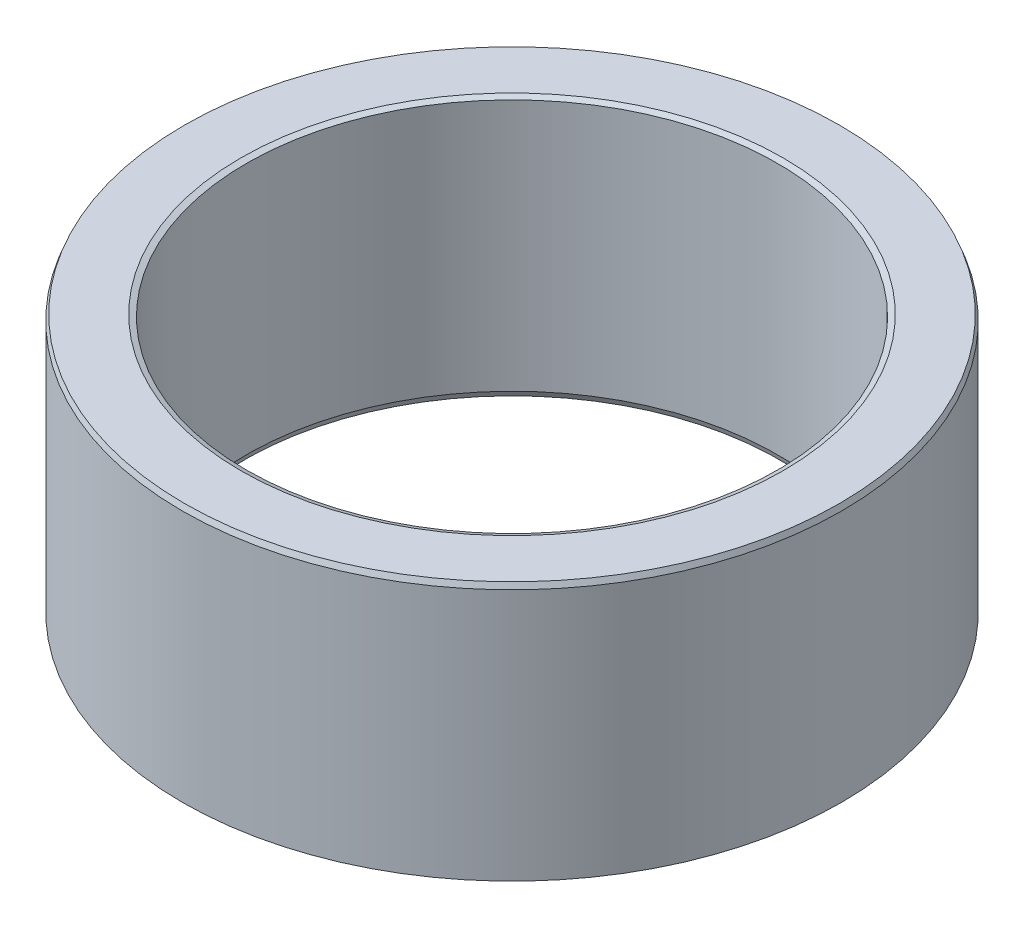
from build123d import *
from OCP.BRepFilletAPI import BRepFilletAPI_MakeChamfer

# Parameters (mm, degrees)
SKETCH1_R           = 57.5
BOSS_EXTRUDE1_DEPTH = 45.326889382
SKETCH2_R           = 46.317969934
CUT_EXTRUDE1_DEPTH  = 94.096868374
CHAMFER1_SIZE       = 0.954511824
CHAMFER1_SIZE2      = 0.363444751


with BuildPart() as part:
    # Sketch1 → Boss-Extrude1 (new body)
    with BuildSketch(Plane(origin=(0, 0, 0), x_dir=(1, 0, 0), z_dir=(0, 1, 0))):
        Circle(SKETCH1_R)
    extrude(amount=BOSS_EXTRUDE1_DEPTH)

    # Sketch2 → Cut-Extrude1 (cut, through all)
    with BuildSketch(Plane(origin=(0, 0, 0), x_dir=(1, 0, 0), z_dir=(0, 1, 0))):
        Circle(SKETCH2_R)
    extrude(amount=CUT_EXTRUDE1_DEPTH, mode=Mode.SUBTRACT)

    # Chamfer1: one chamfer whose edges measure the first distance from different faces: ONE call of the kernel's chamfer builder (chamfer() names one face for all edges)
    chamfer1_edges_1 = [part.edges().sort_by_distance(p)[0] for p in [
        (-46.317969934, 45.326889382, 0),
    ]]
    chamfer1_side_1 = [part.faces().sort_by_distance(p)[0] for p in [
        (-55.873654403, 45.326889382, 0),
    ]]
    chamfer1_edges_2 = [part.edges().sort_by_distance(p)[0] for p in [
        (-46.317969934, 0, 0),
    ]]
    chamfer1_side_2 = [part.faces().sort_by_distance(p)[0] for p in [
        (-46.317969934, 22.663444691, 0),
    ]]
    chamfer1_edges_3 = [part.edges().sort_by_distance(p)[0] for p in [
        (-57.5, 0, 0),
    ]]
    chamfer1_side_3 = [part.faces().sort_by_distance(p)[0] for p in [
        (-55.873654403, 0, 0),
    ]]
    chamfer1_edges_4 = [part.edges().sort_by_distance(p)[0] for p in [
        (-57.5, 45.326889382, 0),
    ]]
    chamfer1_side_4 = [part.faces().sort_by_distance(p)[0] for p in [
        (-57.5, 22.663444691, 0),
    ]]
    chamfer1 = BRepFilletAPI_MakeChamfer(part.part.solid().wrapped)
    for e in chamfer1_edges_1:
        chamfer1.Add(CHAMFER1_SIZE, CHAMFER1_SIZE2, e.wrapped, chamfer1_side_1[0].wrapped)  # the first distance lies on this face
    for e in chamfer1_edges_2:
        chamfer1.Add(CHAMFER1_SIZE, CHAMFER1_SIZE2, e.wrapped, chamfer1_side_2[0].wrapped)  # the first distance lies on this face
    for e in chamfer1_edges_3:
        chamfer1.Add(CHAMFER1_SIZE, CHAMFER1_SIZE2, e.wrapped, chamfer1_side_3[0].wrapped)  # the first distance lies on this face
    for e in chamfer1_edges_4:
        chamfer1.Add(CHAMFER1_SIZE, CHAMFER1_SIZE2, e.wrapped, chamfer1_side_4[0].wrapped)  # the first distance lies on this face
    add(Compound.cast(chamfer1.Shape()), mode=Mode.REPLACE)


solid = part.part
